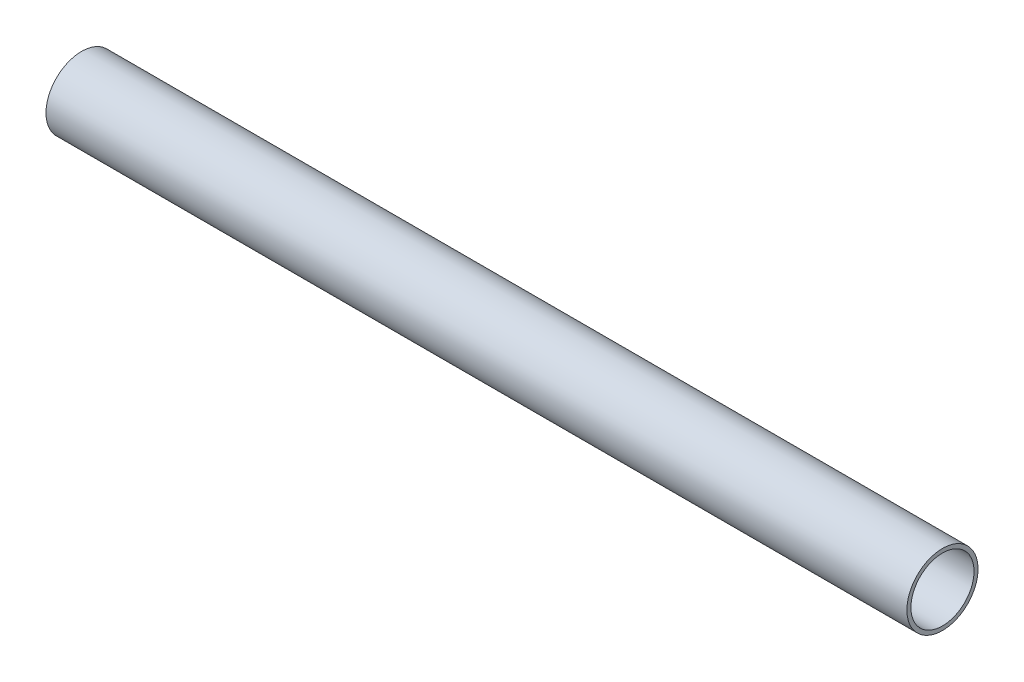
from build123d import *

# Parameters (mm, degrees)
SKETCH1_R           = 1.5748
SKETCH1_R_2         = 1.397
BOSS_EXTRUDE1_DEPTH = 38.1


with BuildPart() as part:
    # Sketch1 → Boss-Extrude1 (new body)
    with BuildSketch(Plane(origin=(0, 0, 0), x_dir=(0, 0, -1), z_dir=(1, 0, 0))):
        Circle(SKETCH1_R)
        Circle(SKETCH1_R_2, mode=Mode.SUBTRACT)
    extrude(amount=BOSS_EXTRUDE1_DEPTH)


solid = part.part
